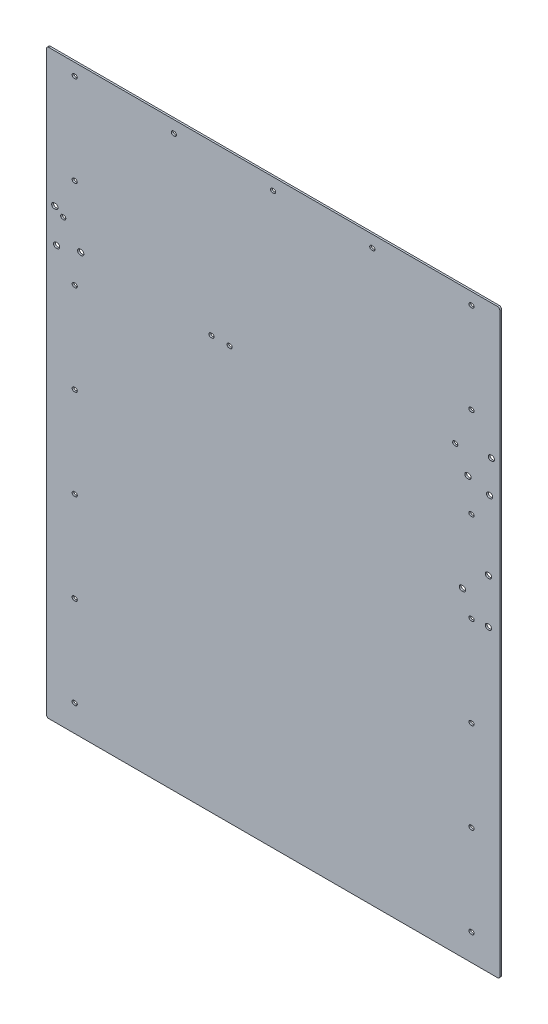
from build123d import *

# Parameters (mm, degrees)
CONVERT_SOLID1_START = -1.5
CONVERT_SOLID1_DEPTH = 1.5


# Read off the part's stored shape, not the designer's step: Convert-Solid1
with BuildPart() as part:
    # Convert-Solid1 outline → Convert-Solid1 (new body)
    with BuildSketch(Plane.XY.offset(CONVERT_SOLID1_START)):
        with BuildLine():
            Line((376, 2), (376, 480))
            ThreePointArc((376, 480), (375.414213562, 481.414213562), (374, 482))
            Line((374, 482), (2, 482))
            ThreePointArc((2, 482), (0.585786438, 481.414213562), (0, 480))
            Line((0, 480), (0, 2))
            ThreePointArc((0, 2), (0.585786438, 0.585786438), (2, 0))
            Line((2, 0), (374, 0))
            ThreePointArc((374, 0), (375.414213562, 0.585786438), (376, 2))
        make_face()
        with BuildLine():
            ThreePointArc((24, 23.65), (25.65, 22), (24, 20.35))
            Line((24, 20.35), (23, 20.35))
            ThreePointArc((23, 20.35), (21.35, 22), (23, 23.65))
            Line((23, 23.65), (24, 23.65))
        make_face(mode=Mode.SUBTRACT)
        with BuildLine():
            ThreePointArc((24, 98.65), (25.65, 97), (24, 95.35))
            Line((24, 95.35), (23, 95.35))
            ThreePointArc((23, 95.35), (21.35, 97), (23, 98.65))
            Line((23, 98.65), (24, 98.65))
        make_face(mode=Mode.SUBTRACT)
        with BuildLine():
            ThreePointArc((24, 173.65), (25.65, 172), (24, 170.35))
            Line((24, 170.35), (23, 170.35))
            ThreePointArc((23, 170.35), (21.35, 172), (23, 173.65))
            Line((23, 173.65), (24, 173.65))
        make_face(mode=Mode.SUBTRACT)
        with BuildLine():
            ThreePointArc((353, 23.65), (354.65, 22), (353, 20.35))
            Line((353, 20.35), (352, 20.35))
            ThreePointArc((352, 20.35), (350.35, 22), (352, 23.65))
            Line((352, 23.65), (353, 23.65))
        make_face(mode=Mode.SUBTRACT)
        with BuildLine():
            ThreePointArc((353, 98.65), (354.65, 97), (353, 95.35))
            Line((353, 95.35), (352, 95.35))
            ThreePointArc((352, 95.35), (350.35, 97), (352, 98.65))
            Line((352, 98.65), (353, 98.65))
        make_face(mode=Mode.SUBTRACT)
        with BuildLine():
            ThreePointArc((353, 173.65), (354.65, 172), (353, 170.35))
            Line((353, 170.35), (352, 170.35))
            ThreePointArc((352, 170.35), (350.35, 172), (352, 173.65))
            Line((352, 173.65), (353, 173.65))
        make_face(mode=Mode.SUBTRACT)
        with BuildLine():
            ThreePointArc((24, 248.65), (25.65, 247), (24, 245.35))
            Line((24, 245.35), (23, 245.35))
            ThreePointArc((23, 245.35), (21.35, 247), (23, 248.65))
            Line((23, 248.65), (24, 248.65))
        make_face(mode=Mode.SUBTRACT)
        with BuildLine():
            ThreePointArc((24, 323.65), (25.65, 322), (24, 320.35))
            Line((24, 320.35), (23, 320.35))
            ThreePointArc((23, 320.35), (21.35, 322), (23, 323.65))
            Line((23, 323.65), (24, 323.65))
        make_face(mode=Mode.SUBTRACT)
        with BuildLine():
            ThreePointArc((8.98683607, 345.178083895), (11.08683607, 343.078083895), (8.98683607, 340.978083895))
            Line((8.98683607, 340.978083895), (7.98683607, 340.978083895))
            ThreePointArc((7.98683607, 340.978083895), (5.88683607, 343.078083895), (7.98683607, 345.178083895))
            Line((7.98683607, 345.178083895), (8.98683607, 345.178083895))
        make_face(mode=Mode.SUBTRACT)
        with BuildLine():
            ThreePointArc((28.98683607, 350.178083895), (31.08683607, 348.078083895), (28.98683607, 345.978083895))
            Line((28.98683607, 345.978083895), (27.98683607, 345.978083895))
            ThreePointArc((27.98683607, 345.978083895), (25.88683607, 348.078083895), (27.98683607, 350.178083895))
            Line((27.98683607, 350.178083895), (28.98683607, 350.178083895))
        make_face(mode=Mode.SUBTRACT)
        with BuildLine():
            ThreePointArc((137.48683607, 344.228083895), (139.13683607, 342.578083895), (137.48683607, 340.928083895))
            Line((137.48683607, 340.928083895), (136.48683607, 340.928083895))
            ThreePointArc((136.48683607, 340.928083895), (134.83683607, 342.578083895), (136.48683607, 344.228083895))
            Line((136.48683607, 344.228083895), (137.48683607, 344.228083895))
        make_face(mode=Mode.SUBTRACT)
        with BuildLine():
            ThreePointArc((152.48683607, 344.228083895), (154.13683607, 342.578083895), (152.48683607, 340.928083895))
            Line((152.48683607, 340.928083895), (151.48683607, 340.928083895))
            ThreePointArc((151.48683607, 340.928083895), (149.83683607, 342.578083895), (151.48683607, 344.228083895))
            Line((151.48683607, 344.228083895), (152.48683607, 344.228083895))
        make_face(mode=Mode.SUBTRACT)
        with BuildLine():
            ThreePointArc((7.48683607, 372.678083895), (9.58683607, 370.578083895), (7.48683607, 368.478083895))
            Line((7.48683607, 368.478083895), (6.48683607, 368.478083895))
            ThreePointArc((6.48683607, 368.478083895), (4.38683607, 370.578083895), (6.48683607, 372.678083895))
            Line((6.48683607, 372.678083895), (7.48683607, 372.678083895))
        make_face(mode=Mode.SUBTRACT)
        with BuildLine():
            ThreePointArc((14.48683607, 367.728083895), (16.13683607, 366.078083895), (14.48683607, 364.428083895))
            Line((14.48683607, 364.428083895), (13.48683607, 364.428083895))
            ThreePointArc((13.48683607, 364.428083895), (11.83683607, 366.078083895), (13.48683607, 367.728083895))
            Line((13.48683607, 367.728083895), (14.48683607, 367.728083895))
        make_face(mode=Mode.SUBTRACT)
        with BuildLine():
            ThreePointArc((24, 398.65), (25.65, 397), (24, 395.35))
            Line((24, 395.35), (23, 395.35))
            ThreePointArc((23, 395.35), (21.35, 397), (23, 398.65))
            Line((23, 398.65), (24, 398.65))
        make_face(mode=Mode.SUBTRACT)
        with BuildLine():
            ThreePointArc((24, 473.65), (25.65, 472), (24, 470.35))
            Line((24, 470.35), (23, 470.35))
            ThreePointArc((23, 470.35), (21.35, 472), (23, 473.65))
            Line((23, 473.65), (24, 473.65))
        make_face(mode=Mode.SUBTRACT)
        with BuildLine():
            ThreePointArc((106.25, 473.65), (107.9, 472), (106.25, 470.35))
            Line((106.25, 470.35), (105.25, 470.35))
            ThreePointArc((105.25, 470.35), (103.6, 472), (105.25, 473.65))
            Line((105.25, 473.65), (106.25, 473.65))
        make_face(mode=Mode.SUBTRACT)
        with BuildLine():
            ThreePointArc((345.51316393, 267.178083895), (347.61316393, 265.078083895), (345.51316393, 262.978083895))
            Line((345.51316393, 262.978083895), (344.51316393, 262.978083895))
            ThreePointArc((344.51316393, 262.978083895), (342.41316393, 265.078083895), (344.51316393, 267.178083895))
            Line((344.51316393, 267.178083895), (345.51316393, 267.178083895))
        make_face(mode=Mode.SUBTRACT)
        with BuildLine():
            ThreePointArc((353, 248.65), (354.65, 247), (353, 245.35))
            Line((353, 245.35), (352, 245.35))
            ThreePointArc((352, 245.35), (350.35, 247), (352, 248.65))
            Line((352, 248.65), (353, 248.65))
        make_face(mode=Mode.SUBTRACT)
        with BuildLine():
            ThreePointArc((367.01316393, 250.178083895), (369.11316393, 248.078083895), (367.01316393, 245.978083895))
            Line((367.01316393, 245.978083895), (366.01316393, 245.978083895))
            ThreePointArc((366.01316393, 245.978083895), (363.91316393, 248.078083895), (366.01316393, 250.178083895))
            Line((366.01316393, 250.178083895), (367.01316393, 250.178083895))
        make_face(mode=Mode.SUBTRACT)
        with BuildLine():
            ThreePointArc((367.01316393, 287.178083895), (369.11316393, 285.078083895), (367.01316393, 282.978083895))
            Line((367.01316393, 282.978083895), (366.01316393, 282.978083895))
            ThreePointArc((366.01316393, 282.978083895), (363.91316393, 285.078083895), (366.01316393, 287.178083895))
            Line((366.01316393, 287.178083895), (367.01316393, 287.178083895))
        make_face(mode=Mode.SUBTRACT)
        with BuildLine():
            ThreePointArc((353, 323.65), (354.65, 322), (353, 320.35))
            Line((353, 320.35), (352, 320.35))
            ThreePointArc((352, 320.35), (350.35, 322), (352, 323.65))
            Line((352, 323.65), (353, 323.65))
        make_face(mode=Mode.SUBTRACT)
        with BuildLine():
            ThreePointArc((350.01316393, 350.178083895), (352.11316393, 348.078083895), (350.01316393, 345.978083895))
            Line((350.01316393, 345.978083895), (349.01316393, 345.978083895))
            ThreePointArc((349.01316393, 345.978083895), (346.91316393, 348.078083895), (349.01316393, 350.178083895))
            Line((349.01316393, 350.178083895), (350.01316393, 350.178083895))
        make_face(mode=Mode.SUBTRACT)
        with BuildLine():
            ThreePointArc((368.01316393, 345.178083895), (370.11316393, 343.078083895), (368.01316393, 340.978083895))
            Line((368.01316393, 340.978083895), (367.01316393, 340.978083895))
            ThreePointArc((367.01316393, 340.978083895), (364.91316393, 343.078083895), (367.01316393, 345.178083895))
            Line((367.01316393, 345.178083895), (368.01316393, 345.178083895))
        make_face(mode=Mode.SUBTRACT)
        with BuildLine():
            ThreePointArc((188.5, 473.65), (190.15, 472), (188.5, 470.35))
            Line((188.5, 470.35), (187.5, 470.35))
            ThreePointArc((187.5, 470.35), (185.85, 472), (187.5, 473.65))
            Line((187.5, 473.65), (188.5, 473.65))
        make_face(mode=Mode.SUBTRACT)
        with BuildLine():
            ThreePointArc((270.75, 473.65), (272.4, 472), (270.75, 470.35))
            Line((270.75, 470.35), (269.75, 470.35))
            ThreePointArc((269.75, 470.35), (268.1, 472), (269.75, 473.65))
            Line((269.75, 473.65), (270.75, 473.65))
        make_face(mode=Mode.SUBTRACT)
        with BuildLine():
            ThreePointArc((339.51316393, 367.728083895), (341.16316393, 366.078083895), (339.51316393, 364.428083895))
            Line((339.51316393, 364.428083895), (338.51316393, 364.428083895))
            ThreePointArc((338.51316393, 364.428083895), (336.86316393, 366.078083895), (338.51316393, 367.728083895))
            Line((338.51316393, 367.728083895), (339.51316393, 367.728083895))
        make_face(mode=Mode.SUBTRACT)
        with BuildLine():
            ThreePointArc((369.51316393, 372.678083895), (371.61316393, 370.578083895), (369.51316393, 368.478083895))
            Line((369.51316393, 368.478083895), (368.51316393, 368.478083895))
            ThreePointArc((368.51316393, 368.478083895), (366.41316393, 370.578083895), (368.51316393, 372.678083895))
            Line((368.51316393, 372.678083895), (369.51316393, 372.678083895))
        make_face(mode=Mode.SUBTRACT)
        with BuildLine():
            ThreePointArc((353, 398.65), (354.65, 397), (353, 395.35))
            Line((353, 395.35), (352, 395.35))
            ThreePointArc((352, 395.35), (350.35, 397), (352, 398.65))
            Line((352, 398.65), (353, 398.65))
        make_face(mode=Mode.SUBTRACT)
        with BuildLine():
            ThreePointArc((353, 473.65), (354.65, 472), (353, 470.35))
            Line((353, 470.35), (352, 470.35))
            ThreePointArc((352, 470.35), (350.35, 472), (352, 473.65))
            Line((352, 473.65), (353, 473.65))
        make_face(mode=Mode.SUBTRACT)
    extrude(amount=CONVERT_SOLID1_DEPTH)


solid = part.part
